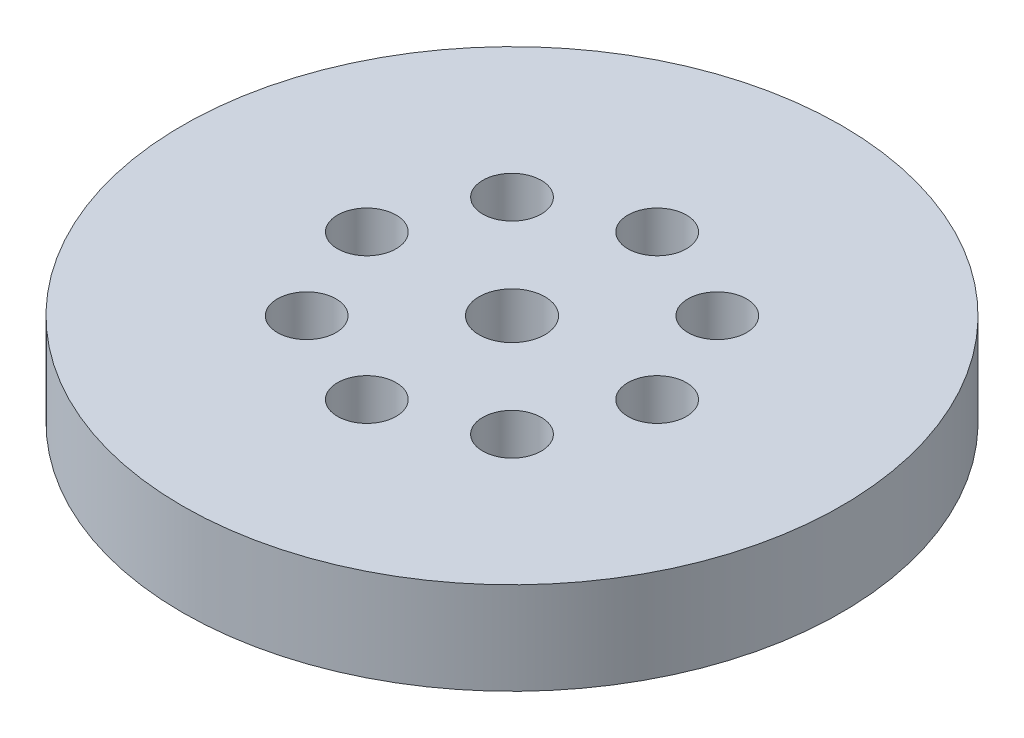
from build123d import *

# Parameters (mm, degrees)
SKETCH1_R           = 100
BOSS_EXTRUDE1_DEPTH = 28
SKETCH2_R           = 10
CUT_EXTRUDE1_DEPTH  = 145.166570328
SKETCH3_R           = 8.88611574
CUT_EXTRUDE2_DEPTH  = 19.862515875
CIRPATTERN1_COUNT   = 8


with BuildPart() as part:
    # Sketch1 → Boss-Extrude1 (new body)
    with BuildSketch(Plane(origin=(0, 0, 0), x_dir=(1, 0, 0), z_dir=(0, 1, 0))):
        Circle(SKETCH1_R)
    extrude(amount=BOSS_EXTRUDE1_DEPTH)

    # Sketch2 → Cut-Extrude1 (cut, through all)
    with BuildSketch(Plane(origin=(0, 0, 0), x_dir=(1, 0, 0), z_dir=(0, 1, 0))):
        Circle(SKETCH2_R)
    extrude(amount=CUT_EXTRUDE1_DEPTH, mode=Mode.SUBTRACT)

    # Sketch3 → Cut-Extrude2 (cut)
    with BuildSketch(Plane(origin=(0, 28, 0), x_dir=(1, 0, 0), z_dir=(0, 1, 0))):
        with Locations((-44.047523464, 0)):
            Circle(SKETCH3_R)
    cut_extrude2 = extrude(amount=-CUT_EXTRUDE2_DEPTH, mode=Mode.SUBTRACT)

    # CirPattern1: Cut-Extrude2 ×8 about axis
    cirpattern1_axis = Axis((0, 0, 0), (0, 1, 0))
    for i in range(1, CIRPATTERN1_COUNT):
        add(cut_extrude2.rotate(cirpattern1_axis, i * 360 / CIRPATTERN1_COUNT), mode=Mode.SUBTRACT)


solid = part.part
